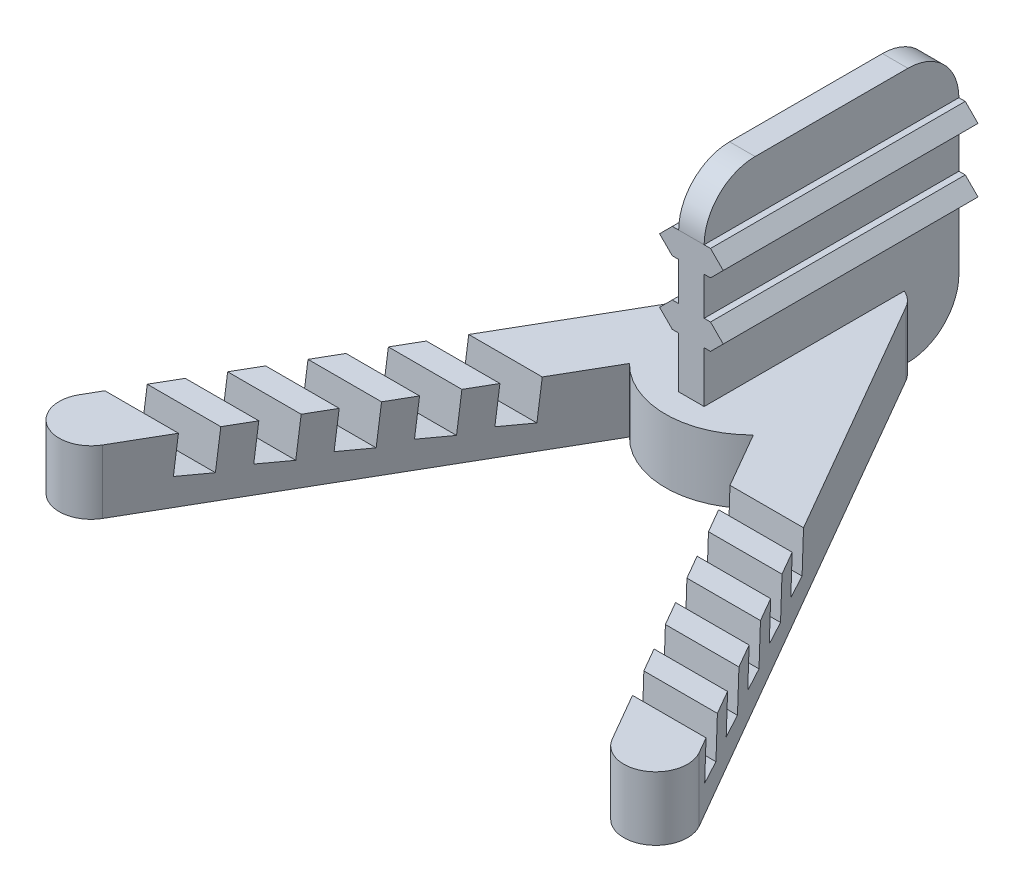
from build123d import *

# Parameters (mm, degrees)
BASE_DEPTH           = 5
BOARDSLOT_DEPTH      = 45.86446744
BOARDSLOT_DEPTH_BACK = 45.86446744
SUPPORTMOUNT_DEPTH   = 5
BOSS_EXTRUDE1_DEPTH  = 1
SKETCH10_W           = 20
SKETCH10_H           = 2
BOSS_EXTRUDE2_DEPTH  = 2.5
CHAMFER1_SIZE        = 1


with BuildPart() as part:
    # Sketch1 → Base (new body)
    with BuildSketch(Plane(origin=(0, 0, 0), x_dir=(1, 0, 0), z_dir=(0, 1, 0))):
        with BuildLine():
            Line((-24.330127019, -2.5), (-2.165063509, 35.891016151))
            ThreePointArc((-2.165063509, 35.891016151), (0, 37.141016151), (2.165063509, 35.891016151))
            Line((2.165063509, 35.891016151), (24.330127019, -2.5))
            ThreePointArc((24.330127019, -2.5), (23.415063509, -5.915063509), (20, -5))
            Line((20, -5), (2.165063509, 25.891016151))
            ThreePointArc((2.165063509, 25.891016151), (0, 27.141016151), (-2.165063509, 25.891016151))
            Line((-2.165063509, 25.891016151), (-20, -5))
            ThreePointArc((-20, -5), (-23.415063509, -5.915063509), (-24.330127019, -2.5))
        make_face()
    extrude(amount=BASE_DEPTH)

    # Sketch2 → BoardSlot (cut, two sides: drawn at the far end of the back side and taken through both)
    with BuildSketch(Plane(origin=(0, 0, 0), x_dir=(0, 0, -1), z_dir=(1, 0, 0)).offset(-BOARDSLOT_DEPTH_BACK)):
        Polygon((-1.481783147, 2.110540039), (-0.610225719, 12.07248702), (1.481783147, 11.889459961), (0.610225719, 1.92751298), align=None)
        Polygon((3.389774281, 12.07248702), (5.481783147, 11.889459961), (4.610225719, 1.92751298), (2.518216853, 2.110540039), align=None)
        Polygon((7.389774281, 12.07248702), (9.481783147, 11.889459961), (8.610225719, 1.92751298), (6.518216853, 2.110540039), align=None)
        Polygon((11.389774281, 12.07248702), (13.481783147, 11.889459961), (12.610225719, 1.92751298), (10.518216853, 2.110540039), align=None)
        Polygon((15.389774281, 12.07248702), (17.481783147, 11.889459961), (16.610225719, 1.92751298), (14.518216853, 2.110540039), align=None)
    extrude(amount=BOARDSLOT_DEPTH + BOARDSLOT_DEPTH_BACK, mode=Mode.SUBTRACT)

    # Sketch3 → SupportMount (add)
    with BuildSketch(Plane(origin=(0, 0, 0), x_dir=(1, 0, 0), z_dir=(0, 1, 0))):
        with BuildLine():
            Line((5.906733437, 29.410253733), (2.165063509, 35.891016151))
            ThreePointArc((2.165063509, 35.891016151), (0, 37.141016151), (-2.165063509, 35.891016151))
            Line((-2.165063509, 35.891016151), (-5.906733437, 29.410253733))
            ThreePointArc((-5.906733437, 29.410253733), (0, 19.179491924), (5.906733437, 29.410253733))
        make_face()
    extrude(amount=SUPPORTMOUNT_DEPTH)

    # Sketch9 → Boss-Extrude1 (add, symmetric)
    with BuildSketch(Plane(origin=(0, 0, 0), x_dir=(0, 0, -1), z_dir=(1, 0, 0))):
        with BuildLine():
            Line((21.217819535, 0), (37.217819535, 0))
            ThreePointArc((37.217819535, 0), (40.04624666, 1.171572875), (41.217819535, 4))
            Line((41.217819535, 4), (41.217819535, 16))
            ThreePointArc((41.217819535, 16), (40.04624666, 18.828427125), (37.217819535, 20))
            Line((37.217819535, 20), (25.217819535, 20))
            ThreePointArc((25.217819535, 20), (22.38939241, 18.828427125), (21.217819535, 16))
            Line((21.217819535, 16), (21.217819535, 0))
        make_face()
    extrude(amount=BOSS_EXTRUDE1_DEPTH, both=True)

    # Sketch10 → Boss-Extrude2 (add, symmetric)
    with BuildSketch(Plane(origin=(0, 0, 0), x_dir=(0, 0, -1), z_dir=(1, 0, 0))):
        with Locations((31.217819535, 15)):
            Rectangle(SKETCH10_W, SKETCH10_H)
        with Locations((31.217819535, 10)):
            Rectangle(SKETCH10_W, SKETCH10_H)
    extrude(amount=BOSS_EXTRUDE2_DEPTH, both=True)

    # Chamfer1
    chamfer1_edges = [part.edges().sort_by_distance(p)[0] for p in [
        (-2.5, 9, -31.217819535),
        (-2.5, 11, -31.217819535),
        (-2.5, 14, -31.217819535),
        (-2.5, 16, -31.217819535),
        (2.5, 9, -31.217819535),
        (2.5, 11, -31.217819535),
        (2.5, 14, -31.217819535),
        (2.5, 16, -31.217819535),
    ]]
    chamfer(chamfer1_edges, length=CHAMFER1_SIZE - 0.0001)  # a hair under: the kernel refuses the full size


solid = part.part
